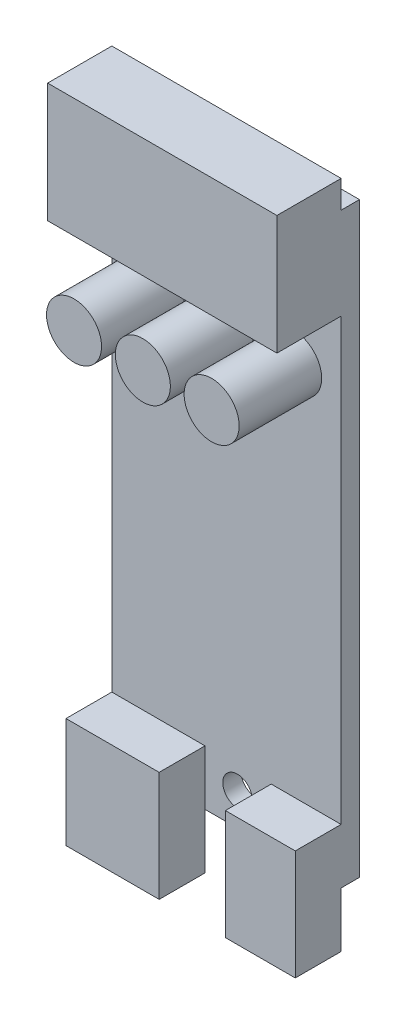
from build123d import *

# Parameters (mm, degrees)
SKETCH1_W                      = 25
SKETCH1_H                      = 67
BOSS_EXTRUDE1_DEPTH            = 9
SKETCH2_W                      = 2
SKETCH2_H                      = 3
CUT_EXTRUDE1_DEPTH             = 73.076348409
SKETCH3_W                      = 7
SKETCH3_H                      = 54
CUT_EXTRUDE2_DEPTH             = 73.076348409
BOSS_EXTRUDE2_DEPTH            = 10.16
BOSS_EXTRUDE3_DEPTH            = 7.62
SKETCH6_W                      = 3
SKETCH6_H                      = 9
SKETCH7_W                      = 3
SKETCH7_H                      = 9
SKETCH8_W                      = 3
SKETCH8_H                      = 9
F_3_2_3_2_DIAMETER_HOLE1_D     = 3.2
F_3_2_3_2_DIAMETER_HOLE1_DEPTH = 11


with BuildPart() as part:
    # Sketch1 → Boss-Extrude1 (new body)
    with BuildSketch(Plane(origin=(0, 0, 0), x_dir=(-1, 0, 0), z_dir=(0, 0, -1))):
        with Locations((-12.5, 33.5)):
            Rectangle(SKETCH1_W, SKETCH1_H)
    extrude(amount=-BOSS_EXTRUDE1_DEPTH)

    # Sketch2 → Cut-Extrude1 (cut, through all)
    with BuildSketch(Plane.ZY):
        with Locations((1, 65.5)):
            Rectangle(SKETCH2_W, SKETCH2_H)
    extrude(amount=-CUT_EXTRUDE1_DEPTH, mode=Mode.SUBTRACT)

    # Sketch3 → Cut-Extrude2 (cut, through all)
    with BuildSketch(Plane.ZY):
        with Locations((5.5, 27)):
            Rectangle(SKETCH3_W, SKETCH3_H)
    extrude(amount=-CUT_EXTRUDE2_DEPTH, mode=Mode.SUBTRACT)

    # Sketch4 → Boss-Extrude2 (add)
    with BuildSketch(Plane(origin=(0, 0, 0), x_dir=(0, -1, 0), z_dir=(-1, 0, 0))):
        Polygon((-6, 2), (0, 2), (6, 2), (6, 7), (-6, 7), align=None)
    extrude(amount=-BOSS_EXTRUDE2_DEPTH)

    # Sketch5 → Boss-Extrude3 (add)
    with BuildSketch(Plane(origin=(25, 0, 0), x_dir=(0, 0, -1), z_dir=(1, 0, 0))):
        Polygon((-2, 0), (-2, 6), (-7, 6), (-7, -6), (-2, -6), align=None)
    extrude(amount=-BOSS_EXTRUDE3_DEPTH)

    # Sketch6 → Revolve1 (revolve)
    with BuildSketch(Plane.XZ.offset(-47.064665705)):
        with Locations((21.380279303, 6.5)):
            Rectangle(SKETCH6_W, SKETCH6_H)
    revolve(axis=Axis((19.880279303, 47.064665705, 11), (0, 0, -1)))

    # Sketch7 → Revolve2 (revolve)
    with BuildSketch(Plane.XZ.offset(-47.064665705)):
        with Locations((13.880279303, 6.5)):
            Rectangle(SKETCH7_W, SKETCH7_H)
    revolve(axis=Axis((12.380279303, 47.064665705, 11), (0, 0, -1)))

    # Sketch8 → Revolve3 (revolve)
    with BuildSketch(Plane.XZ.offset(-47.064665705)):
        with Locations((6.380279303, 6.5)):
            Rectangle(SKETCH8_W, SKETCH8_H)
    revolve(axis=Axis((4.880279303, 47.064665705, 11), (0, 0, -1)))

    # Ø3.2 (3.2) Diameter Hole1
    with Locations(Plane(origin=(0, 0, 0), x_dir=(-1, 0, 0), z_dir=(0, 0, -1))):
        with Locations((-15.2, 40.7), (-13.7, 3.5)):
            Hole(F_3_2_3_2_DIAMETER_HOLE1_D / 2, depth=F_3_2_3_2_DIAMETER_HOLE1_DEPTH)


solid = part.part
